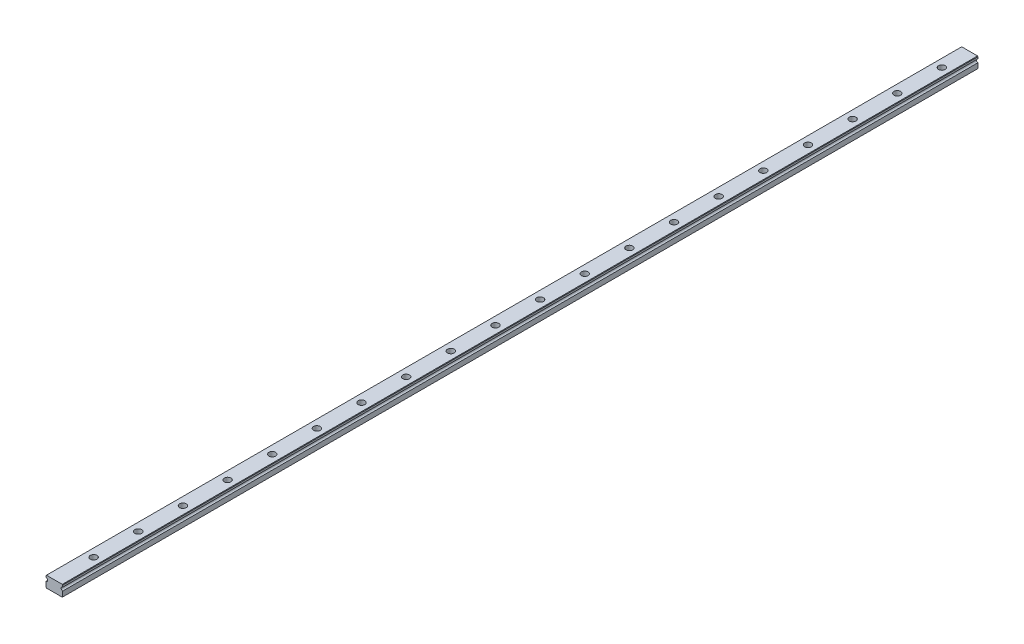
from build123d import *

# Parameters (mm, degrees)
EXTRUDE_1_DEPTH        = 1000
SKETCH_2_R             = 1.5
CUT_EXTRUDE_1_DEPTH    = 20
SKETCH_3_R             = 3
CUT_EXTRUDE_2_DEPTH    = 4.5
PATTERN_LINEAR_1_COUNT = 25
PATTERN_LINEAR_1_PITCH = 40
CUT_EXTRUDE_4_DEPTH    = 80
CUT_EXTRUDE_5_DEPTH    = 80
CUT_EXTRUDE_6_DEPTH    = 20


with BuildPart() as part:
    # 草图1 → 凸台-拉伸1 (new body)
    with BuildSketch(Plane.XY):
        with BuildLine():
            Line((-7.643186957, 0.234233912), (-7.643186957, -4.365766088))
            Line((-7.643186957, -4.365766088), (-7.243186957, -4.765766088))
            Line((-7.243186957, -4.765766088), (6.956813043, -4.765766088))
            Line((6.956813043, -4.765766088), (7.356813043, -4.365766088))
            Line((7.356813043, -4.365766088), (7.356813043, 0.234233912))
            ThreePointArc((7.356813043, 0.234233912), (6.296152871, 0.67357374), (5.856813043, 1.734233912))
            ThreePointArc((5.856813043, 1.734233912), (6.296152871, 2.794894084), (7.356813043, 3.234233912))
            Line((7.356813043, 3.234233912), (7.356813043, 4.834233912))
            Line((7.356813043, 4.834233912), (6.956813043, 5.234233912))
            Line((6.956813043, 5.234233912), (-7.243186957, 5.234233912))
            Line((-7.243186957, 5.234233912), (-7.643186957, 4.834233912))
            Line((-7.643186957, 4.834233912), (-7.643186957, 3.234233912))
            ThreePointArc((-7.643186957, 3.234233912), (-6.143186957, 1.734233912), (-7.643186957, 0.234233912))
        make_face()
    extrude(amount=EXTRUDE_1_DEPTH)

    # 草图2 → 切除-拉伸1 (cut)
    with BuildSketch(Plane(origin=(0, 5.234233912, 0), x_dir=(1, 0, 0), z_dir=(0, 1, 0))):
        with Locations((0, -4.968968642)):
            Circle(SKETCH_2_R)
    cut_extrude_1 = extrude(amount=-CUT_EXTRUDE_1_DEPTH, mode=Mode.SUBTRACT)

    # 草图3 → 切除-拉伸2 (cut)
    with BuildSketch(Plane(origin=(0, 5.234233912, 0), x_dir=(1, 0, 0), z_dir=(0, 1, 0))):
        with Locations((0, -4.968968642)):
            Circle(SKETCH_3_R)
    cut_extrude_2 = extrude(amount=-CUT_EXTRUDE_2_DEPTH, mode=Mode.SUBTRACT)

    # 阵列(线性)1: 切除-拉伸1, 切除-拉伸2 ×25
    with Locations(*[(0, 0, i * PATTERN_LINEAR_1_PITCH) for i in range(1, PATTERN_LINEAR_1_COUNT)]):
        add(cut_extrude_1, mode=Mode.SUBTRACT)
        add(cut_extrude_2, mode=Mode.SUBTRACT)

    # 草图6 → 切除-拉伸4 (cut)
    with BuildSketch(Plane(origin=(0, 0, 0), x_dir=(-1, 0, 0), z_dir=(0, 0, -1))):
        with BuildLine():
            Line((7.643186957, 3.234233912), (7.643186957, 4.834233912))
            Line((7.643186957, 4.834233912), (7.243186957, 5.234233912))
            Line((7.243186957, 5.234233912), (-6.956813043, 5.234233912))
            Line((-6.956813043, 5.234233912), (-7.356813043, 4.834233912))
            Line((-7.356813043, 4.834233912), (-7.356813043, 3.234233912))
            ThreePointArc((-7.356813043, 3.234233912), (-5.856813043, 1.734233912), (-7.356813043, 0.234233912))
            Line((-7.356813043, 0.234233912), (-7.356813043, -4.365766088))
            Line((-7.356813043, -4.365766088), (-6.956813043, -4.765766088))
            Line((-6.956813043, -4.765766088), (7.243186957, -4.765766088))
            Line((7.243186957, -4.765766088), (7.643186957, -4.365766088))
            Line((7.643186957, -4.365766088), (7.643186957, 0.234233912))
            ThreePointArc((7.643186957, 0.234233912), (6.143186957, 1.734233912), (7.643186957, 3.234233912))
        make_face()
    extrude(amount=-CUT_EXTRUDE_4_DEPTH, mode=Mode.SUBTRACT)

    # 草图7 → 切除-拉伸5 (cut)
    with BuildSketch(Plane(origin=(0, 0, 80), x_dir=(-1, 0, 0), z_dir=(0, 0, -1))):
        with BuildLine():
            Line((7.643186957, 3.234233912), (7.643186957, 4.834233912))
            Line((7.643186957, 4.834233912), (7.243186957, 5.234233912))
            Line((7.243186957, 5.234233912), (-6.956813043, 5.234233912))
            Line((-6.956813043, 5.234233912), (-7.356813043, 4.834233912))
            Line((-7.356813043, 4.834233912), (-7.356813043, 3.234233912))
            ThreePointArc((-7.356813043, 3.234233912), (-5.856813043, 1.734233912), (-7.356813043, 0.234233912))
            Line((-7.356813043, 0.234233912), (-7.356813043, -4.365766088))
            Line((-7.356813043, -4.365766088), (-6.956813043, -4.765766088))
            Line((-6.956813043, -4.765766088), (7.243186957, -4.765766088))
            Line((7.243186957, -4.765766088), (7.643186957, -4.365766088))
            Line((7.643186957, -4.365766088), (7.643186957, 0.234233912))
            ThreePointArc((7.643186957, 0.234233912), (6.143186957, 1.734233912), (7.643186957, 3.234233912))
        make_face()
    extrude(amount=-CUT_EXTRUDE_5_DEPTH, mode=Mode.SUBTRACT)

    # 草图8 → 切除-拉伸6 (cut)
    with BuildSketch(Plane(origin=(0, 0, 160), x_dir=(-1, 0, 0), z_dir=(0, 0, -1))):
        with BuildLine():
            Line((7.643186957, 3.234233912), (7.643186957, 4.834233912))
            Line((7.643186957, 4.834233912), (7.243186957, 5.234233912))
            Line((7.243186957, 5.234233912), (-6.956813043, 5.234233912))
            Line((-6.956813043, 5.234233912), (-7.356813043, 4.834233912))
            Line((-7.356813043, 4.834233912), (-7.356813043, 3.234233912))
            ThreePointArc((-7.356813043, 3.234233912), (-5.856813043, 1.734233912), (-7.356813043, 0.234233912))
            Line((-7.356813043, 0.234233912), (-7.356813043, -4.365766088))
            Line((-7.356813043, -4.365766088), (-6.956813043, -4.765766088))
            Line((-6.956813043, -4.765766088), (7.243186957, -4.765766088))
            Line((7.243186957, -4.765766088), (7.643186957, -4.365766088))
            Line((7.643186957, -4.365766088), (7.643186957, 0.234233912))
            ThreePointArc((7.643186957, 0.234233912), (6.143186957, 1.734233912), (7.643186957, 3.234233912))
        make_face()
    extrude(amount=-CUT_EXTRUDE_6_DEPTH, mode=Mode.SUBTRACT)


solid = part.part
